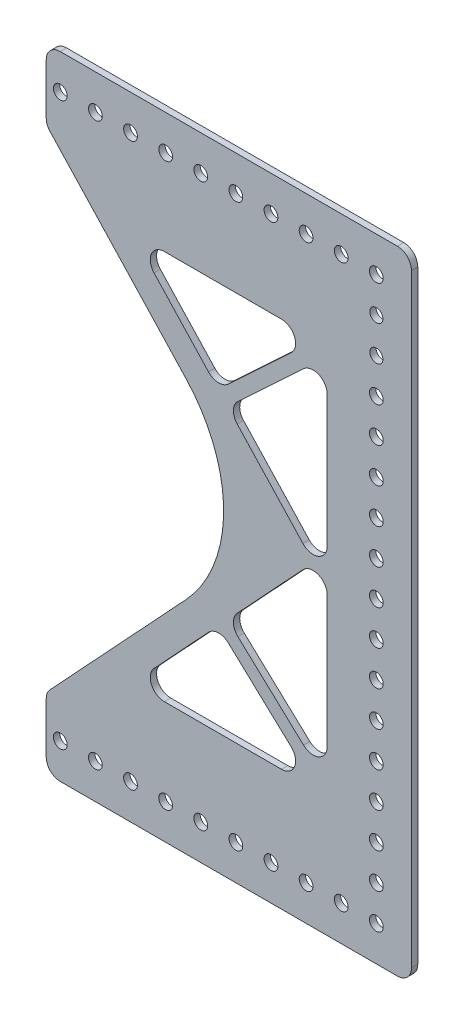
from build123d import *

# Parameters (mm, degrees)
SKETCH1_R           = 2.4892
SKETCH1_R_2         = 2.37186857
BOSS_EXTRUDE1_DEPTH = 2.286


with BuildPart() as part:
    # Sketch1 → Boss-Extrude1 (new body)
    with BuildSketch(Plane.XY):
        with BuildLine():
            Line((238.806714439, 781.287169191), (222.296714439, 781.287169191))
            Line((222.296714439, 781.287169191), (176.576714439, 781.287169191))
            Line((176.576714439, 781.287169191), (116.886714439, 781.287169191))
            ThreePointArc((116.886714439, 781.287169191), (113.29461199, 779.799271639), (111.806714439, 776.207169191))
            Line((111.806714439, 776.207169191), (111.806714439, 757.885949725))
            ThreePointArc((111.806714439, 757.885949725), (112.159468576, 756.025964093), (113.16874064, 754.424292487))
            Line((113.16874064, 754.424292487), (162.347850631, 701.603741569))
            ThreePointArc((162.347850631, 701.603741569), (175.968112644, 666.987169191), (162.347850631, 632.370596813))
            Line((162.347850631, 632.370596813), (113.16874064, 579.550045895))
            ThreePointArc((113.16874064, 579.550045895), (112.159468576, 577.948374289), (111.806714439, 576.088388657))
            Line((111.806714439, 576.088388657), (111.806714439, 557.767169191))
            ThreePointArc((111.806714439, 557.767169191), (113.29461199, 554.175066742), (116.886714439, 552.687169191))
            Line((116.886714439, 552.687169191), (176.576714439, 552.687169191))
            Line((176.576714439, 552.687169191), (222.296714439, 552.687169191))
            Line((222.296714439, 552.687169191), (238.806714439, 552.687169191))
            ThreePointArc((238.806714439, 552.687169191), (242.398816887, 554.175066742), (243.886714439, 557.767169191))
            Line((243.886714439, 557.767169191), (243.886714439, 666.987169191))
            Line((243.886714439, 666.987169191), (243.886714439, 776.207169191))
            ThreePointArc((243.886714439, 776.207169191), (242.398816887, 779.799271639), (238.806714439, 781.287169191))
        make_face()
        with Locations((142.286714439, 768.587169191)):
            Circle(SKETCH1_R, mode=Mode.SUBTRACT)
        with Locations((154.986714439, 768.587169191)):
            Circle(SKETCH1_R, mode=Mode.SUBTRACT)
        with Locations((167.686714439, 768.587169191)):
            Circle(SKETCH1_R, mode=Mode.SUBTRACT)
        with Locations((231.186714439, 743.187169191)):
            Circle(SKETCH1_R_2, mode=Mode.SUBTRACT)
        with Locations((231.186714439, 730.487169191)):
            Circle(SKETCH1_R, mode=Mode.SUBTRACT)
        with Locations((231.186714439, 717.787169191)):
            Circle(SKETCH1_R, mode=Mode.SUBTRACT)
        with Locations((231.186714439, 705.087169191)):
            Circle(SKETCH1_R, mode=Mode.SUBTRACT)
        with Locations((231.186714439, 692.387169191)):
            Circle(SKETCH1_R, mode=Mode.SUBTRACT)
        with Locations((167.686714439, 565.387169191)):
            Circle(SKETCH1_R, mode=Mode.SUBTRACT)
        with Locations((154.986714439, 565.387169191)):
            Circle(SKETCH1_R, mode=Mode.SUBTRACT)
        with Locations((142.286714439, 565.387169191)):
            Circle(SKETCH1_R, mode=Mode.SUBTRACT)
        with Locations((231.186714439, 616.187169191)):
            Circle(SKETCH1_R, mode=Mode.SUBTRACT)
        with Locations((231.186714439, 603.487169191)):
            Circle(SKETCH1_R, mode=Mode.SUBTRACT)
        with Locations((231.186714439, 590.787169191)):
            Circle(SKETCH1_R, mode=Mode.SUBTRACT)
        with Locations((231.186714439, 565.387169191)):
            Circle(SKETCH1_R, mode=Mode.SUBTRACT)
        with Locations((231.186714439, 768.587169191)):
            Circle(SKETCH1_R, mode=Mode.SUBTRACT)
        with Locations((231.186714439, 654.287169191)):
            Circle(SKETCH1_R, mode=Mode.SUBTRACT)
        with Locations((231.186714439, 641.587169191)):
            Circle(SKETCH1_R, mode=Mode.SUBTRACT)
        with Locations((231.186714439, 628.887169191)):
            Circle(SKETCH1_R, mode=Mode.SUBTRACT)
        with Locations((116.886714439, 768.587169191)):
            Circle(SKETCH1_R, mode=Mode.SUBTRACT)
        with Locations((129.586714439, 768.587169191)):
            Circle(SKETCH1_R, mode=Mode.SUBTRACT)
        with Locations((129.586714439, 565.387169191)):
            Circle(SKETCH1_R, mode=Mode.SUBTRACT)
        with Locations((116.886714439, 565.387169191)):
            Circle(SKETCH1_R, mode=Mode.SUBTRACT)
        with Locations((231.186714439, 679.687169191)):
            Circle(SKETCH1_R, mode=Mode.SUBTRACT)
        with Locations((231.186714439, 666.987169191)):
            Circle(SKETCH1_R, mode=Mode.SUBTRACT)
        with Locations((231.186714439, 755.887169191)):
            Circle(SKETCH1_R_2, mode=Mode.SUBTRACT)
        with Locations((231.186714439, 578.087169191)):
            Circle(SKETCH1_R, mode=Mode.SUBTRACT)
        with Locations((180.386714439, 565.387169191)):
            Circle(SKETCH1_R, mode=Mode.SUBTRACT)
        with Locations((193.086714439, 565.387169191)):
            Circle(SKETCH1_R, mode=Mode.SUBTRACT)
        with Locations((205.786714439, 565.387169191)):
            Circle(SKETCH1_R, mode=Mode.SUBTRACT)
        with Locations((218.486714439, 565.387169191)):
            Circle(SKETCH1_R, mode=Mode.SUBTRACT)
        with Locations((180.386714439, 768.587169191)):
            Circle(SKETCH1_R, mode=Mode.SUBTRACT)
        with Locations((193.086714439, 768.587169191)):
            Circle(SKETCH1_R, mode=Mode.SUBTRACT)
        with Locations((205.786714439, 768.587169191)):
            Circle(SKETCH1_R, mode=Mode.SUBTRACT)
        with Locations((218.486714439, 768.587169191)):
            Circle(SKETCH1_R, mode=Mode.SUBTRACT)
        with BuildLine():
            Line((150.786953537, 728.930511953), (170.473797978, 707.785965632))
            ThreePointArc((170.473797978, 707.785965632), (174.010528598, 706.170857078), (177.653429014, 707.529649071))
            Line((177.653429014, 707.529649071), (200.363611972, 728.674195392))
            ThreePointArc((200.363611972, 728.674195392), (201.629200597, 734.252154823), (196.901954734, 737.472169191))
            Line((196.901954734, 737.472169191), (154.504927335, 737.472169191))
            ThreePointArc((154.504927335, 737.472169191), (149.847051276, 734.419628344), (150.786953537, 728.930511953))
        make_face(mode=Mode.SUBTRACT)
        with BuildLine():
            Line((213.406714439, 674.585176614), (213.406714439, 722.206352957))
            ThreePointArc((213.406714439, 722.206352957), (210.354173591, 726.864229016), (204.865057201, 725.924326755))
            Line((204.865057201, 725.924326755), (181.115086252, 703.811675273))
            ThreePointArc((181.115086252, 703.811675273), (179.499977697, 700.274944652), (180.858769691, 696.632044236))
            Line((180.858769691, 696.632044236), (204.60874064, 671.123519376))
            ThreePointArc((204.60874064, 671.123519376), (210.186700071, 669.857930751), (213.406714439, 674.585176614))
        make_face(mode=Mode.SUBTRACT)
        with BuildLine():
            Line((180.858769691, 637.342294146), (204.60874064, 662.850819006))
            ThreePointArc((204.60874064, 662.850819006), (210.186700071, 664.116407631), (213.406714439, 659.389161768))
            Line((213.406714439, 659.389161768), (213.406714439, 611.767985425))
            ThreePointArc((213.406714439, 611.767985425), (210.354173591, 607.110109366), (204.865057201, 608.050011626))
            Line((204.865057201, 608.050011626), (181.115086252, 630.162663109))
            ThreePointArc((181.115086252, 630.162663109), (179.499977697, 633.699393729), (180.858769691, 637.342294146))
        make_face(mode=Mode.SUBTRACT)
        with BuildLine():
            Line((200.363611972, 605.30014299), (177.653429014, 626.44468931))
            ThreePointArc((177.653429014, 626.44468931), (174.010528598, 627.803481304), (170.473797978, 626.188372749))
            Line((170.473797978, 626.188372749), (150.786953537, 605.043826429))
            ThreePointArc((150.786953537, 605.043826429), (149.847051276, 599.554710038), (154.504927335, 596.502169191))
            Line((154.504927335, 596.502169191), (196.901954734, 596.502169191))
            ThreePointArc((196.901954734, 596.502169191), (201.629200597, 599.722183559), (200.363611972, 605.30014299))
        make_face(mode=Mode.SUBTRACT)
    extrude(amount=BOSS_EXTRUDE1_DEPTH)


solid = part.part
